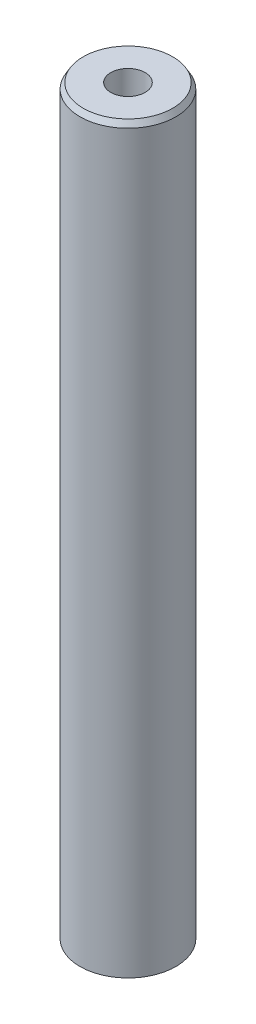
from build123d import *
from OCP.BRepFilletAPI import BRepFilletAPI_MakeChamfer

# Parameters (mm, degrees)
SKETCH1_R           = 32.5
BOSS_EXTRUDE1_DEPTH = 504.307032384
SKETCH2_R           = 11.646204447
CUT_EXTRUDE1_DEPTH  = 507.397159265
CHAMFER1_SIZE       = 3.865722478
CHAMFER1_SIZE2      = 2.241831541


with BuildPart() as part:
    # Sketch1 → Boss-Extrude1 (new body)
    with BuildSketch(Plane(origin=(0, 0, 0), x_dir=(1, 0, 0), z_dir=(0, 1, 0))):
        Circle(SKETCH1_R)
    extrude(amount=BOSS_EXTRUDE1_DEPTH)

    # Sketch2 → Cut-Extrude1 (cut, through all)
    with BuildSketch(Plane(origin=(0, 0, 0), x_dir=(1, 0, 0), z_dir=(0, 1, 0))):
        Circle(SKETCH2_R)
    extrude(amount=CUT_EXTRUDE1_DEPTH, mode=Mode.SUBTRACT)

    # Chamfer1: one chamfer whose edges measure the first distance from different faces: ONE call of the kernel's chamfer builder (chamfer() names one face for all edges)
    chamfer1_edges_1 = [part.edges().sort_by_distance(p)[0] for p in [
        (-32.5, 504.307032384, 0),
    ]]
    chamfer1_side_1 = [part.faces().sort_by_distance(p)[0] for p in [
        (-32.5, 252.153516192, 0),
    ]]
    chamfer1_edges_2 = [part.edges().sort_by_distance(p)[0] for p in [
        (-32.5, 0, 0),
    ]]
    chamfer1_side_2 = [part.faces().sort_by_distance(p)[0] for p in [
        (-31.580761184, 0, 0),
    ]]
    chamfer1 = BRepFilletAPI_MakeChamfer(part.part.solid().wrapped)
    for e in chamfer1_edges_1:
        chamfer1.Add(CHAMFER1_SIZE, CHAMFER1_SIZE2, e.wrapped, chamfer1_side_1[0].wrapped)  # the first distance lies on this face
    for e in chamfer1_edges_2:
        chamfer1.Add(CHAMFER1_SIZE, CHAMFER1_SIZE2, e.wrapped, chamfer1_side_2[0].wrapped)  # the first distance lies on this face
    add(Compound.cast(chamfer1.Shape()), mode=Mode.REPLACE)


solid = part.part
